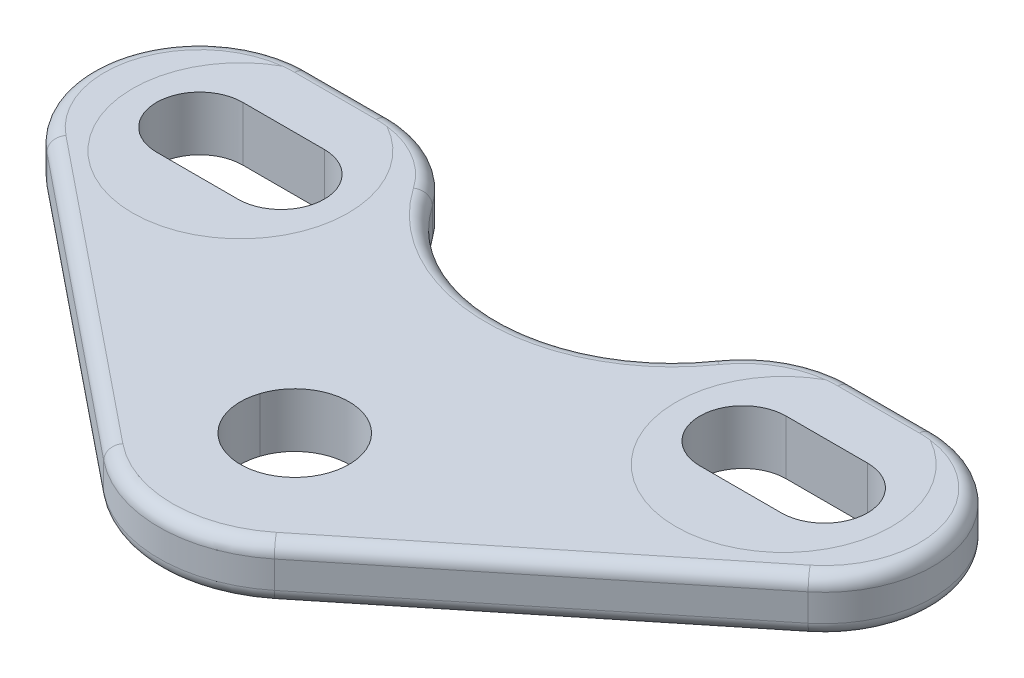
from build123d import *

# Parameters (mm, degrees)
SKETCH1_R           = 4
BOSS_EXTRUDE1_DEPTH = 4
FILLET1_R           = 1


with BuildPart() as part:
    # Sketch1 → Boss-Extrude1 (new body)
    with BuildSketch(Plane(origin=(0, 0, 0), x_dir=(1, 0, 0), z_dir=(0, 1, 0))):
        with BuildLine():
            Line((-28.025651318, -6.22437377), (-6.282064148, -23.780467212))
            ThreePointArc((-6.282064148, -23.780467212), (0, -26), (6.282064148, -23.780467212))
            Line((6.282064148, -23.780467212), (28.025651318, -6.22437377))
            ThreePointArc((28.025651318, -6.22437377), (30.543042826, 2.665052517), (23, 8))
            Line((23, 8), (17, 8))
            ThreePointArc((17, 8), (13.292968107, 7.089281666), (10.429951691, 4.564478636))
            ThreePointArc((10.429951691, 4.564478636), (0, -0.88941153), (-10.429951691, 4.564478636))
            ThreePointArc((-10.429951691, 4.564478636), (-13.292968107, 7.089281666), (-17, 8))
            Line((-17, 8), (-23, 8))
            ThreePointArc((-23, 8), (-30.543042826, 2.665052517), (-28.025651318, -6.22437377))
        make_face()
        with Locations((0, -16)):
            Circle(SKETCH1_R, mode=Mode.SUBTRACT)
        with BuildLine():
            Line((-23, 3.175), (-17, 3.175))
            ThreePointArc((-17, 3.175), (-13.825, 0), (-17, -3.175))
            Line((-17, -3.175), (-23, -3.175))
            ThreePointArc((-23, -3.175), (-26.175, 0), (-23, 3.175))
        make_face(mode=Mode.SUBTRACT)
        with BuildLine():
            Line((17, 3.175), (23, 3.175))
            ThreePointArc((23, 3.175), (26.175, 0), (23, -3.175))
            Line((23, -3.175), (17, -3.175))
            ThreePointArc((17, -3.175), (13.825, 0), (17, 3.175))
        make_face(mode=Mode.SUBTRACT)
    extrude(amount=BOSS_EXTRUDE1_DEPTH)

    # Fillet1
    fillet1_edges = [part.edges().sort_by_distance(p)[0] for p in [
        (-30.543042826, 0, -2.665052517),
        (30.543042826, 0, -2.665052517),
        (17.153857733, 0, 15.002420491),
        (0, 0, 26),
        (-30.543042826, 4, -2.665052517),
        (30.543042826, 4, -2.665052517),
        (17.153857733, 4, 15.002420491),
        (0, 4, 26),
        (-17.153857733, 0, 15.002420491),
        (-17.153857733, 4, 15.002420491),
        (-13.292968107, 0, -7.089281666),
        (-20, 0, -8),
        (13.292968107, 0, -7.089281666),
        (20, 0, -8),
        (-13.292968107, 4, -7.089281666),
        (-20, 4, -8),
        (13.292968107, 4, -7.089281666),
        (20, 4, -8),
        (0, 0, 0.88941153),
        (0, 4, 0.88941153),
    ]]
    fillet(fillet1_edges, radius=FILLET1_R)


solid = part.part
